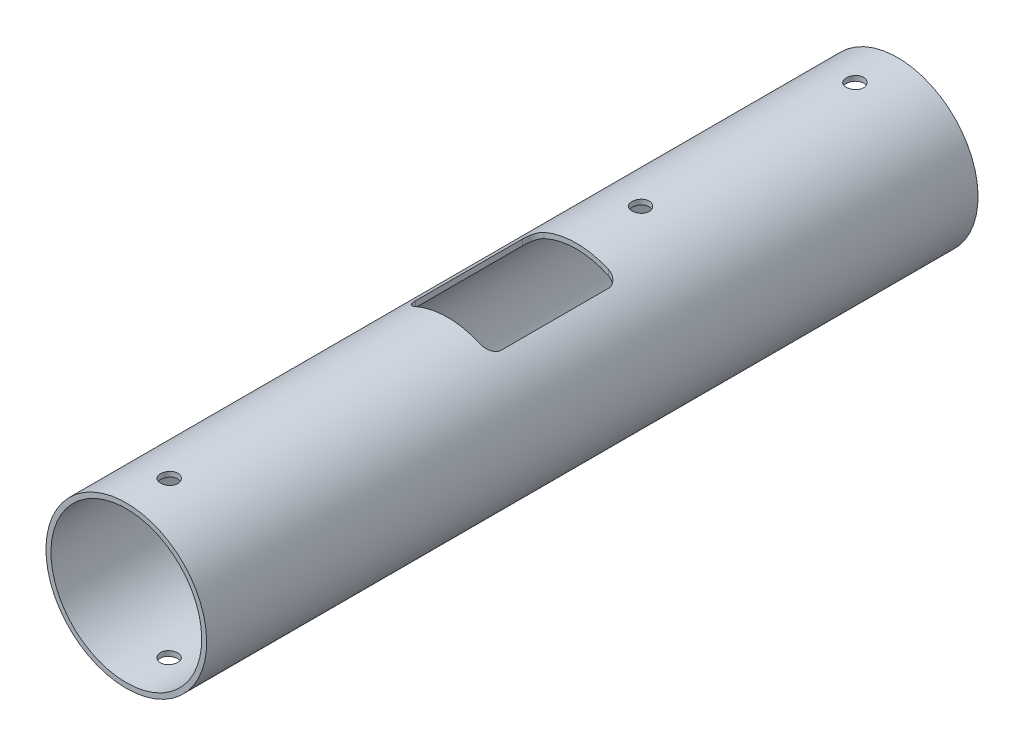
from build123d import *

# Parameters (mm, degrees)
SKETCH3_W               = 228.6
SKETCH3_H               = 1.4732
CUT_EXTRUDE1_DEPTH      = 120.15771193
CUT_EXTRUDE1_DEPTH_BACK = 120.15771193
SKETCH4_R               = 2.5527
CUT_EXTRUDE2_DEPTH      = 120.157712066


with BuildPart() as part:
    # Sketch3 → Revolve1 (revolve)
    with BuildSketch(Plane(origin=(0, 0, 0), x_dir=(0, 0, -1), z_dir=(1, 0, 0))):
        with Locations((0, 23.0759)):
            Rectangle(SKETCH3_W, SKETCH3_H)
    revolve(axis=Axis((0, 0, 114.3), (0, 0, -1)))

    # Sketch4 → Cut-Extrude1 (cut, two sides: drawn at the far end of the back side and taken through both)
    with BuildSketch(Plane(origin=(0, 0, 0), x_dir=(1, 0, 0), z_dir=(0, 1, 0)).offset(-CUT_EXTRUDE1_DEPTH_BACK)):
        with Locations((0, 101.6)):
            Circle(SKETCH4_R)
        with Locations((0, 38.1)):
            Circle(SKETCH4_R)
        with Locations((0, -101.6)):
            Circle(SKETCH4_R)
    extrude(amount=CUT_EXTRUDE1_DEPTH + CUT_EXTRUDE1_DEPTH_BACK, mode=Mode.SUBTRACT)

    # Sketch5 → Cut-Extrude2 (cut, through all)
    with BuildSketch(Plane(origin=(0, 0, 0), x_dir=(1, 0, 0), z_dir=(0, 1, 0))):
        with BuildLine():
            Line((9.525, -19.05), (-9.525, -19.05))
            ThreePointArc((-9.525, -19.05), (-11.77006403, -18.12006403), (-12.7, -15.875))
            Line((-12.7, -15.875), (-12.7, 15.875))
            ThreePointArc((-12.7, 15.875), (-11.77006403, 18.12006403), (-9.525, 19.05))
            Line((-9.525, 19.05), (9.525, 19.05))
            ThreePointArc((9.525, 19.05), (11.77006403, 18.12006403), (12.7, 15.875))
            Line((12.7, 15.875), (12.7, -15.875))
            ThreePointArc((12.7, -15.875), (11.77006403, -18.12006403), (9.525, -19.05))
        make_face()
    extrude(amount=CUT_EXTRUDE2_DEPTH, mode=Mode.SUBTRACT)


solid = part.part
